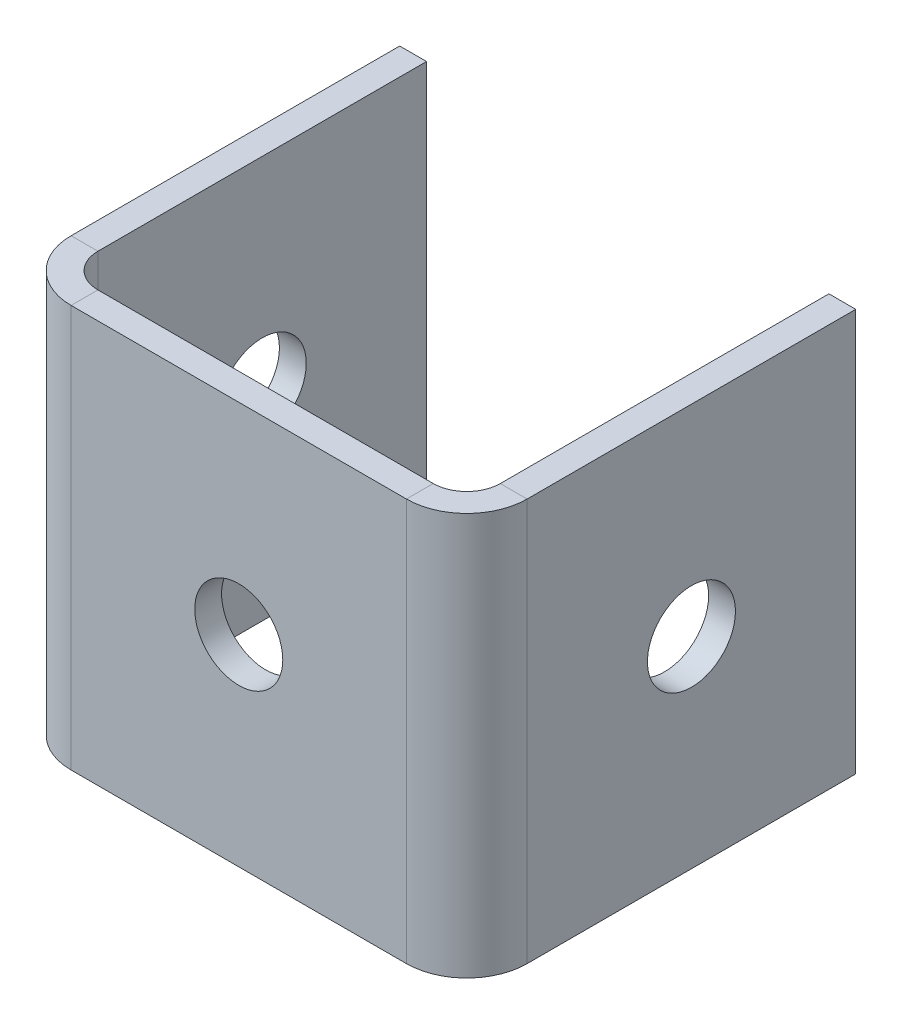
from build123d import *

# Parameters (mm, degrees)
SKETCH2_W                            = 31.75
SKETCH2_H                            = 38.1
BASE_FLANGE1_DEPTH                   = 2.54
EDGE_FLANGE2_DEPTH                   = 38.1
EDGE_FLANGE2_BEND_DEPTH              = 38.1
F_21_64_0_32813_DIAMETER_HOLE1_D     = 8.334502
F_21_64_0_32813_DIAMETER_HOLE1_DEPTH = 25.4
F_21_64_0_32813_DIAMETER_HOLE1_TIP   = 2.503937016
F_21_64_0_32813_DIAMETER_HOLE2_D     = 8.334502


# Sheet-metal steps are written as plain solids
with BuildPart() as part:
    # Sketch2 → Base-Flange1 (new body)
    with BuildSketch(Plane.XY):
        Rectangle(SKETCH2_W, SKETCH2_H)
    extrude(amount=-BASE_FLANGE1_DEPTH)

    # Edge-Flange2 section (across the edge) → Edge-Flange2 (add)
    with BuildSketch(Plane(origin=(19.05, 19.05, -2.54), x_dir=(-1, 0, 0), z_dir=(0, -1, 0))):
        with BuildLine():
            Line((-2.54, 3.175), (-2.54, 34.29))
            Line((-2.54, 34.29), (0, 34.29))
            Line((0, 34.29), (0, 3.175))
            ThreePointArc((0, 3.175), (0.92993597, 0.92993597), (3.175, 0))
            Line((3.175, 0), (3.175, -2.54))
            ThreePointArc((3.175, -2.54), (-0.866115254, -0.866115254), (-2.54, 3.175))
        make_face()
    extrude(amount=EDGE_FLANGE2_DEPTH)

    # Edge-Flange2 section 2 (across the edge) → Edge-Flange2 bend (add)
    with BuildSketch(Plane(origin=(-19.05, -19.05, -2.54), x_dir=(1, 0, 0), z_dir=(0, 1, 0))):
        with BuildLine():
            Line((-2.54, 3.175), (-2.54, 34.29))
            Line((-2.54, 34.29), (0, 34.29))
            Line((0, 34.29), (0, 3.175))
            ThreePointArc((0, 3.175), (0.92993597, 0.92993597), (3.175, 0))
            Line((3.175, 0), (3.175, -2.54))
            ThreePointArc((3.175, -2.54), (-0.866115254, -0.866115254), (-2.54, 3.175))
        make_face()
    extrude(amount=EDGE_FLANGE2_BEND_DEPTH)

    # 21/64 (0.32813) Diameter Hole1
    with Locations(Plane.XY):
        with Locations((0, 0)):
            Hole(F_21_64_0_32813_DIAMETER_HOLE1_D / 2, depth=F_21_64_0_32813_DIAMETER_HOLE1_DEPTH)
            with Locations((0, 0, -(F_21_64_0_32813_DIAMETER_HOLE1_DEPTH + F_21_64_0_32813_DIAMETER_HOLE1_TIP / 2))):  # 118° drill point
                Cone(0, F_21_64_0_32813_DIAMETER_HOLE1_D / 2, F_21_64_0_32813_DIAMETER_HOLE1_TIP, mode=Mode.SUBTRACT)

    # 21/64 (0.32813) Diameter Hole2 (through all)
    with Locations(Plane(origin=(21.59, 0, 0), x_dir=(0, 0, -1), z_dir=(1, 0, 0))):
        with Locations((21.2725, 0)):
            Hole(F_21_64_0_32813_DIAMETER_HOLE2_D / 2)


solid = part.part
